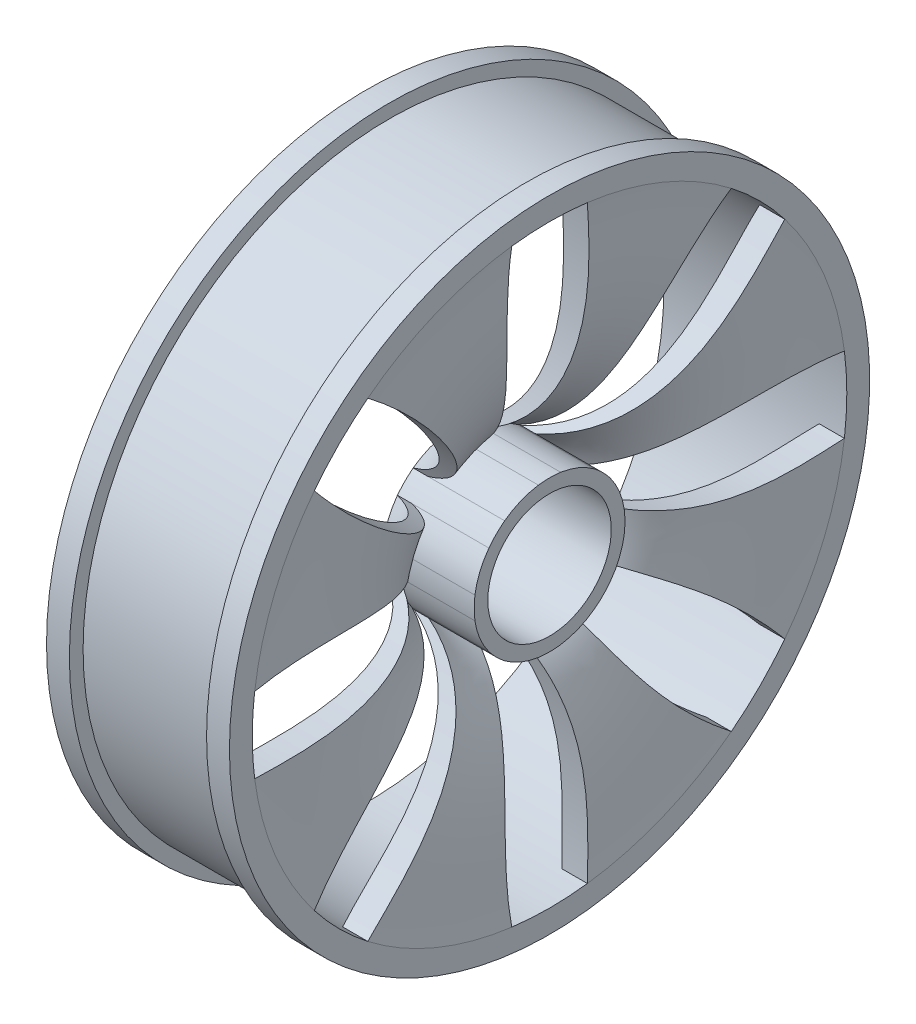
from build123d import *
from build123d.topology import SkipClean

# Parameters (mm, degrees)
CUT_EXTRUDE2_DEPTH = 111.905365064
CIRPATTERN2_COUNT  = 8
SCALE1_SCALE       = 0.5


with BuildPart() as part:
    # Sketch1 → Revolve1 (revolve)
    with BuildSketch(Plane.XY):
        with BuildLine():
            Line((-20, 65), (13.153734129, 65))
            Line((13.153734129, 65), (14.494744631, 65))
            add(Edge.make_bspline(
                [(14.494744631, 65), (12.502206897, 49.490804575), (18.466776671, 25.24835877), (0, 16.5)],
                knots=[0, 0, 0, 0, 1, 1, 1, 1], degree=3))
            Line((0, 16.5), (0, 13.5))
            Line((0, 13.5), (20, 13.5))
            Line((20, 13.5), (20, 16.5))
            Line((20, 16.5), (3.17570815, 16.5))
            add(Edge.make_bspline(
                [(20, 65), (18.806416268, 48.991043123), (21.654091138, 24.896428401), (3.17570815, 16.5)],
                knots=[0, 0, 0, 0, 1, 1, 1, 1], degree=3))
            Line((20, 65), (20, 70))
            Line((20, 70), (15, 70))
            Line((15, 70), (15, 67))
            Line((15, 67), (-15, 67))
            Line((-15, 67), (-15, 70))
            Line((-15, 70), (-20, 70))
            Line((-20, 70), (-20, 65))
        make_face()
    revolve(axis=Axis((0, 0, 0), (1, 0, 0)))

    # Sketch2 → Cut-Extrude2 (cut, through all)
    with BuildSketch(Plane(origin=(30, 0, 0), x_dir=(0, 0, -1), z_dir=(1, 0, 0))):
        with BuildLine():
            ThreePointArc((-8.269543591, 64.471812824), (0, 65), (8.269543591, 64.471812824))
            add(Edge.make_bspline(
                [(8.269543591, 64.471812824), (11.409595508, 39.756229765), (2.435027422, 16.319333364)],
                knots=[0, 0, 0, 1, 1, 1], degree=2))
            ThreePointArc((2.435027422, 16.319333364), (0, 16.484798286), (-2.435027422, 16.319333364))
            add(Edge.make_bspline(
                [(-8.269543591, 64.471812824), (-10.541737717, 39.835341096), (-2.435027422, 16.319333364)],
                knots=[0, 0, 0, 1, 1, 1], degree=2))
        make_face()
    cut_extrude2 = extrude(amount=-CUT_EXTRUDE2_DEPTH, mode=Mode.SUBTRACT)

    # CirPattern2: Cut-Extrude2 ×8 about axis
    with SkipClean():  # the faces are left unmerged after this step: merging them gives an invalid solid
        cirpattern2_axis = Axis((20, 0, 0), (-1, 0, 0))
        for i in range(1, CIRPATTERN2_COUNT):
            add(cut_extrude2.rotate(cirpattern2_axis, i * 360 / CIRPATTERN2_COUNT), mode=Mode.SUBTRACT)
    add(part.part.scale(1), mode=Mode.REPLACE)  # the faces are merged on a copy


with BuildPart() as part_1:
    # Scale1: scaled about (6.956554115, -1.2e-08, 3.79e-07)
    add(part.part.scale(SCALE1_SCALE).moved(Location((3.478277058, -6e-09, 1.89e-07))))


solid = part_1.part
